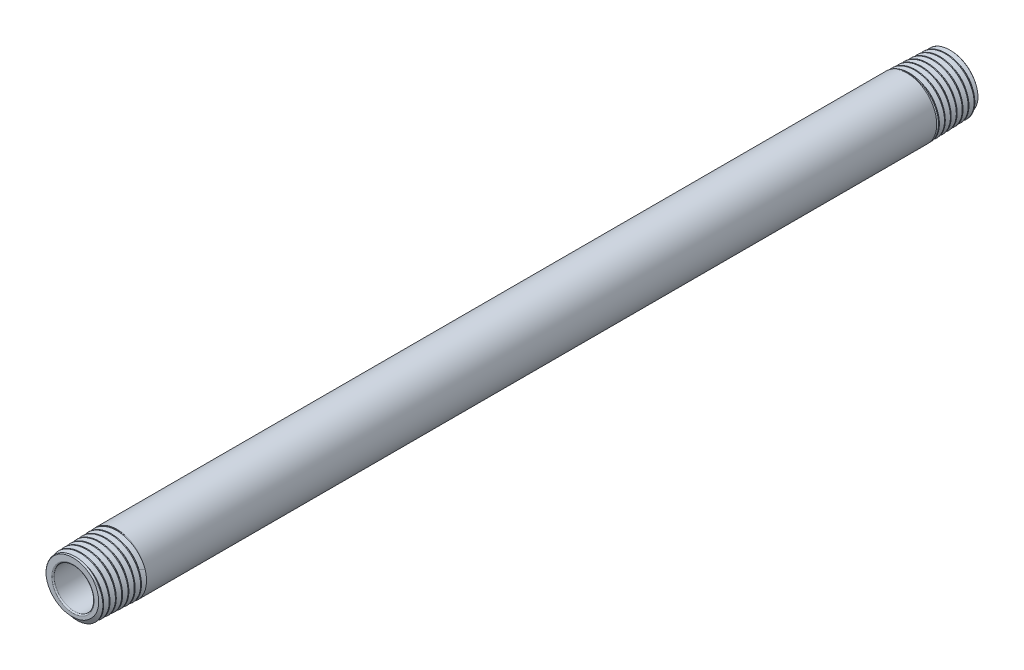
from build123d import *

# Parameters (mm, degrees)
CHAMFER1_SIZE       = 0.2794
CHAMFER1_SIZE2      = 0.28851844
FILLET1_R           = 0.2794
SKETCH6_R           = 6.858
BOSS_EXTRUDE1_DEPTH = 10.16
BOSS_EXTRUDE1_TAPER = 60
SKETCH7_R           = 4.6228
CUT_EXTRUDE1_DEPTH  = 103.061865312
CIRPATTERN1_COUNT   = 2


with BuildPart() as part:
    # Sketch2 → Revolve1 (revolve)
    with BuildSketch(Plane(origin=(0, 0, 0), x_dir=(0, 0, -1), z_dir=(1, 0, 0)), mode=Mode.PRIVATE) as revolve1_sk:
        Polygon((-101.6, 6.541667453), (-91.44, 6.858), (0, 6.858), (0, 4.6228), (-101.6, 4.6228), align=None)
    revolve(revolve1_sk.sketch.rotate(Axis((0, 0, 101.6), (0, 0, -1)), 90), axis=Axis((0, 0, 101.6), (0, 0, -1)))

    # Chamfer1
    chamfer1_edges = [part.edges().sort_by_distance(p)[0] for p in [
        (-6.541667453, 0, 101.6),
    ]]
    chamfer1_side = [part.faces().sort_by_distance(p)[0] for p in [
        (-6.699833727, 0, 96.52),
    ]]
    chamfer(chamfer1_edges, length=CHAMFER1_SIZE, length2=CHAMFER1_SIZE2, reference=chamfer1_side[0])

    # Fillet1
    fillet1_edges = [part.edges().sort_by_distance(p)[0] for p in [
        (-4.6228, 0, 101.6),
    ]]
    fillet(fillet1_edges, radius=FILLET1_R)

    # Mirror1: part across plane


with BuildPart() as part_1:
    add(part.part)
    add(part.part.mirror(Plane.XY))

    # SurfaceCut1
    split(bisect_by=Plane.XY, keep=Keep.TOP)


with BuildPart() as body_2:
    # Split1: the piece on the far side of the plane
    add(part_1.part)
    split(bisect_by=Plane.XY.offset(91.44), keep=Keep.BOTTOM)


with BuildPart() as part_2:
    add(part_1.part)

    # Split1
    split(bisect_by=Plane.XY.offset(91.44), keep=Keep.TOP)

    # Cut-Sweep1: sweep along a curve in space
    with BuildLine() as cut_sweep1_path:
        add(Edge.make_bspline(
            [(0, 6.541667453, 101.6), (0.877709824, 6.54260565, 101.569866898), (1.755426188, 6.36454889, 101.539733796), (3.371979301, 5.678320114, 101.479467593), (4.110112963, 5.170443033, 101.449334491), (5.329171692, 3.905254079, 101.389068287), (5.809565174, 3.148489228, 101.358935185), (6.435843944, 1.506162618, 101.298668981), (6.581454305, 0.621312709, 101.26853588), (6.514293191, -1.13584603, 101.208269676), (6.301547631, -2.007391876, 101.178136574), (5.551090642, -3.598488528, 101.11787037), (5.013702082, -4.317347184, 101.087737269), (3.699370211, -5.487801762, 101.027471065), (2.922995349, -5.938887116, 100.997337963), (1.254483374, -6.501167347, 100.937071759), (0.363069598, -6.612115039, 100.906938657), (-1.393109508, -6.475782942, 100.846672454), (-2.257112152, -6.228559105, 100.816539352), (-3.820197564, -5.414816609, 100.756273148), (-4.518600229, -4.848648353, 100.726140046), (-5.63846858, -3.487042596, 100.665873843), (-6.059445575, -2.692194167, 100.635740741), (-6.556635396, -0.999994035, 100.575474537), (-6.632629256, -0.103376076, 100.545341435), (-6.427099903, 1.649096883, 100.485075231), (-6.145662696, 2.504190681, 100.45494213), (-5.269679132, 4.036744925, 100.394675926), (-4.67551026, 4.713538412, 100.364542824), (-3.268579627, 5.780910407, 100.30427662), (-2.456426715, 6.171022937, 100.274143519), (-0.743081048, 6.602128049, 100.213877315), (0.15736866, 6.642930322, 100.183744213), (1.903405405, 6.368285053, 100.123478009), (2.748233908, 6.05295354, 100.093344907), (4.24777596, 5.115873787, 100.033078704), (4.901836774, 4.494529623, 100.002945602), (5.914877466, 3.044300325, 99.942679398), (6.273414878, 2.21604294, 99.912546296), (6.637540441, 0.484135954, 99.852280093), (6.642967332, -0.418762418, 99.822146991), (6.299395332, -2.155633579, 99.761880787), (5.950542417, -2.988851685, 99.731747685), (4.953610351, -4.452943436, 99.671481481), (4.305961329, -5.083179628, 99.64134838), (2.814533876, -6.040132368, 99.581082176), (1.971401186, -6.366430729, 99.550949074), (0.223554795, -6.662783093, 99.49068287), (-0.680400632, -6.632705236, 99.460549769), (-2.405381798, -6.22050361, 99.400283565), (-3.225657894, -5.838555639, 99.370150463), (-4.651908099, -4.783112521, 99.309884259), (-5.25726108, -4.110072979, 99.279751157), (-6.156450528, -2.579619152, 99.219484954), (-6.449893819, -1.722867659, 99.189351852), (-6.67778211, 0.038262492, 99.129085648), (-6.612124955, 0.941876983, 99.098952546), (-6.131698625, 2.652252983, 99.038686343), (-5.717134899, 3.458271065, 99.008553241), (-4.604617611, 4.84433924, 98.948287037), (-3.90714451, 5.423785548, 98.918153935), (-2.339904207, 6.263620563, 98.857887731), (-1.470815879, 6.523641801, 98.82775463), (0.30091269, 6.682479344, 98.767488426), (1.202784035, 6.581223457, 98.737355324), (2.895853203, 6.033084895, 98.67708912), (3.686314989, 5.586437102, 98.646956019), (5.029915236, 4.418376226, 98.586689815), (5.58246825, 3.697467799, 98.556556713), (6.361444662, 2.095745767, 98.496290509), (6.587526952, 1.215626119, 98.466157407), (6.676832539, -0.563989923, 98.405891204), (6.540013822, -1.462713871, 98.375758102), (5.924782611, -3.135792311, 98.315491898), (5.446634168, -3.909419327, 98.285358796), (4.224651908, -5.208324087, 98.225092593), (3.481346242, -5.733035696, 98.194959491), (1.847508697, -6.449738943, 98.134693287), (0.957684834, -6.641416456, 98.104560185), (-0.827086282, -6.660815453, 98.044293981), (-1.721258724, -6.488525269, 98.01416088), (-3.371684567, -5.806927495, 97.953894676), (-4.127220207, -5.297912817, 97.923761574), (-5.379263938, -4.023720777, 97.86349537), (-5.875226147, -3.259094322, 97.833362269), (-6.528333789, -1.595565458, 97.773096065), (-6.685192659, -0.697384073, 97.742962963), (-6.634417948, 1.089792458, 97.682696759), (-6.426803167, 1.978011621, 97.652563657), (-5.679670645, 3.603149251, 97.592297454), (-5.140474318, 4.339360818, 97.562164352), (-3.815871127, 5.542443584, 97.501898148), (-3.031037147, 6.008790068, 97.471765046), (-1.340295547, 6.597074161, 97.411498843), (-0.435120885, 6.718753304, 97.381365741), (1.35169838, 6.597646062, 97.321099537), (2.232567026, 6.354909017, 97.290966435), (3.829811285, 5.543178344, 97.230700231), (4.545491993, 4.974534231, 97.20056713), (5.697582959, 3.601403025, 97.140300926), (6.133490558, 2.797509982, 97.110167824), (6.655819886, 1.082084927, 97.04990162), (6.742011744, 0.171296711, 97.019768519), (6.550522053, -1.612393852, 96.959502315), (6.272920411, -2.484521474, 96.929369213), (5.397631855, -4.051301832, 96.869103009), (4.800322108, -4.745272777, 96.838969907), (3.380627875, -5.844413619, 96.778703704), (2.558857751, -6.249103764, 96.748570602), (0.821325443, -6.704445931, 96.688304398), (-0.093683227, -6.754897128, 96.658171296), (-1.871469198, -6.493084415, 96.597905093), (-2.733474212, -6.180930959, 96.567771991), (-4.267258899, -5.243227181, 96.507505787), (-4.938370996, -4.618081188, 96.477372685), (-5.982679194, -3.153867968, 96.417106481), (-6.355419274, -2.315434535, 96.38697338), (-6.742842643, -0.558414226, 96.326707176), (-6.757354565, 0.35941055, 96.296574074), (-6.425387878, 2.128515906, 96.23630787), (-6.0790502, 2.979027841, 96.206174769), (-5.080174809, 4.477327926, 96.145908565), (-4.428068052, 5.124463798, 96.115775463), (-2.921456015, 6.112135833, 96.055509259), (-2.067603042, 6.452240491, 96.025376157), (-0.293753093, 6.770915978, 95.965109954), (0.625474352, 6.749345262, 95.934976852), (2.383127268, 6.347503366, 95.874710648), (3.220788941, 5.96740348, 95.844577546), (4.681162363, 4.908699432, 95.784311343), (5.303238195, 4.230552272, 95.754178241), (6.232552626, 2.683734657, 95.693912037), (6.539384986, 1.815734071, 95.663778935), (6.788587694, 0.027747927, 95.603512731), (6.730846637, -0.891461835, 95.57337963), (6.259517949, -2.634899027, 95.513113426), (5.846131809, -3.458368707, 95.482980324), (4.729039636, -4.878424244, 95.42271412), (4.025816031, -5.474391586, 95.392581019), (2.441055964, -6.343712008, 95.332314815), (1.560205954, -6.616684832, 95.302181713), (-0.239191941, -6.795795529, 95.241915509), (-1.156958949, -6.701852412, 95.211782407), (-2.883430018, -6.161534754, 95.151516204), (-3.691383572, -5.715391691, 95.121383102), (-5.068784741, -4.541447578, 95.061116898), (-5.637632261, -3.814153717, 95.030983796), (-6.445410146, -2.193780911, 94.970717593), (-6.683986916, -1.301403992, 94.940584491), (-6.79249335, 0.506654363, 94.880318287), (-6.662372668, 1.421551037, 94.850185185), (-6.053672855, 3.128322804, 94.789918981), (-5.57535493, 3.919455822, 94.75978588), (-4.346188632, 5.25192471, 94.699519676), (-3.595871507, 5.792679897, 94.669386574), (-1.942278846, 6.537457302, 94.60912037), (-1.039719873, 6.74115322, 94.578987269), (0.774225013, 6.778651278, 94.518721065), (1.684823482, 6.612433893, 94.488587963), (3.369184312, 5.936067146, 94.428321759), (4.142214209, 5.426208412, 94.398188657), (5.427535223, 4.14354102, 94.337922454), (5.939266033, 3.371286925, 94.307789352), (6.619678173, 1.686926936, 94.247523148), (6.788061097, 0.775551078, 94.217390046), (6.754255787, -1.041488025, 94.157123843), (6.552078985, -1.946362356, 94.126990741), (5.808868172, -3.605626463, 94.066724537), (5.268153858, -4.359294555, 94.036591435), (3.933795415, -5.595318085, 93.976325231), (3.140728382, -6.07713453, 93.94619213), (1.428109601, -6.691912219, 93.885925926), (0.509300279, -6.824603505, 93.855792824), (-1.308026642, -6.719309782, 93.79552662), (-2.205755072, -6.481367245, 93.765393519), (-3.837266799, -5.672241951, 93.705127315), (-4.570340344, -5.101407562, 93.674994213), (-5.754986337, -3.717254528, 93.614728009), (-6.206042014, -2.904534693, 93.584594907), (-6.754013957, -1.166217939, 93.524328704), (-6.85068923, -0.241374724, 93.494195602), (-6.673832643, 1.573423863, 93.433929398), (-6.400374334, 2.462591036, 93.403796296), (-5.526369763, 4.063729095, 93.343530093), (-4.926200094, 4.775003303, 93.313396991), (-3.494232673, 5.90626474, 93.253130787), (-2.663054587, 6.325758293, 93.222997685), (-0.901649134, 6.805853243, 93.162731481), (0.027814386, 6.866243079, 93.13259838), (1.837263098, 6.617860253, 93.072332176), (2.71646229, 6.30919221, 93.042199074), (4.284643971, 5.371447914, 92.98193287), (4.972943979, 4.74277599, 92.951799769), (6.048890247, 3.265055312, 92.891533565), (6.436066767, 2.41664619, 92.861400463), (6.84731552, 0.63480585, 92.801134259), (6.871206049, -0.297852524, 92.771001157), (6.551444993, -2.099128822, 92.710734954), (6.207929035, -2.966964167, 92.680601852), (5.20768748, -4.499649494, 92.620335648), (4.551393413, -5.163832297, 92.590202546), (3.030058583, -6.18261245, 92.529936343), (2.165676493, -6.536764808, 92.499803241), (0.366095625, -6.878302053, 92.439537037), (-0.568322481, -6.865535475, 92.409403935), (-2.358607226, -6.474655714, 92.349137731), (-3.213695933, -6.096709059, 92.31900463), (-4.708391767, -5.035314021, 92.258738426), (-5.347348104, -4.352323791, 92.228605324), (-6.30719402, -2.789588808, 92.16833912), (-6.627664123, -1.910520807, 92.138206019), (-6.898730131, -0.095930242, 92.077939815), (-6.849205145, 0.838805009, 92.047806713), (-6.387577683, 2.615286874, 91.987540509), (-5.975672477, 3.456261422, 91.957407407), (-4.85456728, 4.91052551, 91.897141204), (-4.145851438, 5.523181708, 91.867008102), (-2.544001979, 6.422411112, 91.806741898), (-1.651562206, 6.708591095, 91.776608796), (0.175274896, 6.908533253, 91.716342593), (1.108879468, 6.8222054, 91.686209491), (2.868759351, 6.290312501, 91.625943287), (3.694269681, 5.844975265, 91.595810185), (5.105714628, 4.665700847, 91.535543981), (5.691034394, 3.932273148, 91.50541088), (6.52805377, 2.293663241, 91.445144676), (6.779387103, 1.389190947, 91.415011574), (6.90766128, -0.447101409, 91.35474537), (6.784543198, -1.378124484, 91.324612269), (6.182977999, -3.118619916, 91.264346065), (5.704788981, -3.927335589, 91.234212963), (4.468981813, -5.293632768, 91.173946759), (3.711897774, -5.850618927, 91.143813657), (2.03894634, -6.623926289, 91.083547454), (1.123803885, -6.839908819, 91.053414352), (-0.719128585, -6.896080569, 90.993148148), (-1.646118601, -6.736242158, 90.963015046), (-3.364468147, -6.065708105, 90.902748843), (-4.155080486, -5.555300548, 90.872615741), (-5.47396386, -4.264690389, 90.812349537), (-6.00166004, -3.485045778, 90.782216435), (-6.709847577, -1.780233075, 90.721950231), (-6.890028481, -0.855803872, 90.69181713), (-6.873774076, 0.990934029, 90.631550926), (-6.677342578, 1.912440949, 90.601417824), (-5.938652687, 3.605908578, 90.54115162), (-5.396712016, 4.377132781, 90.511018519), (-4.053119517, 5.646402645, 90.450752315), (-3.252048772, 6.143894902, 90.420619213), (-1.517912718, 6.78565148, 90.360353009), (-0.585599148, 6.929634143, 90.330219907), (1.26209432, 6.84074144, 90.269953704), (2.176671897, 6.607901424, 90.239820602), (3.842551341, 5.801977365, 90.179554398), (4.593128564, 5.229240287, 90.149421296), (5.810655191, 3.834574444, 90.089155093), (6.277073568, 3.013249031, 90.059021991), (6.564130329, 2.132815233, 90.028888889)],
            knots=[0, 0, 0, 0, 0.0078125, 0.0078125, 0.015625, 0.015625, 0.0234375, 0.0234375, 0.03125, 0.03125, 0.0390625, 0.0390625, 0.046875, 0.046875, 0.0546875, 0.0546875, 0.0625, 0.0625, 0.0703125, 0.0703125, 0.078125, 0.078125, 0.0859375, 0.0859375, 0.09375, 0.09375, 0.1015625, 0.1015625, 0.109375, 0.109375, 0.1171875, 0.1171875, 0.125, 0.125, 0.1328125, 0.1328125, 0.140625, 0.140625, 0.1484375, 0.1484375, 0.15625, 0.15625, 0.1640625, 0.1640625, 0.171875, 0.171875, 0.1796875, 0.1796875, 0.1875, 0.1875, 0.1953125, 0.1953125, 0.203125, 0.203125, 0.2109375, 0.2109375, 0.21875, 0.21875, 0.2265625, 0.2265625, 0.234375, 0.234375, 0.2421875, 0.2421875, 0.25, 0.25, 0.2578125, 0.2578125, 0.265625, 0.265625, 0.2734375, 0.2734375, 0.28125, 0.28125, 0.2890625, 0.2890625, 0.296875, 0.296875, 0.3046875, 0.3046875, 0.3125, 0.3125, 0.3203125, 0.3203125, 0.328125, 0.328125, 0.3359375, 0.3359375, 0.34375, 0.34375, 0.3515625, 0.3515625, 0.359375, 0.359375, 0.3671875, 0.3671875, 0.375, 0.375, 0.3828125, 0.3828125, 0.390625, 0.390625, 0.3984375, 0.3984375, 0.40625, 0.40625, 0.4140625, 0.4140625, 0.421875, 0.421875, 0.4296875, 0.4296875, 0.4375, 0.4375, 0.4453125, 0.4453125, 0.453125, 0.453125, 0.4609375, 0.4609375, 0.46875, 0.46875, 0.4765625, 0.4765625, 0.484375, 0.484375, 0.4921875, 0.4921875, 0.5, 0.5, 0.5078125, 0.5078125, 0.515625, 0.515625, 0.5234375, 0.5234375, 0.53125, 0.53125, 0.5390625, 0.5390625, 0.546875, 0.546875, 0.5546875, 0.5546875, 0.5625, 0.5625, 0.5703125, 0.5703125, 0.578125, 0.578125, 0.5859375, 0.5859375, 0.59375, 0.59375, 0.6015625, 0.6015625, 0.609375, 0.609375, 0.6171875, 0.6171875, 0.625, 0.625, 0.6328125, 0.6328125, 0.640625, 0.640625, 0.6484375, 0.6484375, 0.65625, 0.65625, 0.6640625, 0.6640625, 0.671875, 0.671875, 0.6796875, 0.6796875, 0.6875, 0.6875, 0.6953125, 0.6953125, 0.703125, 0.703125, 0.7109375, 0.7109375, 0.71875, 0.71875, 0.7265625, 0.7265625, 0.734375, 0.734375, 0.7421875, 0.7421875, 0.75, 0.75, 0.7578125, 0.7578125, 0.765625, 0.765625, 0.7734375, 0.7734375, 0.78125, 0.78125, 0.7890625, 0.7890625, 0.796875, 0.796875, 0.8046875, 0.8046875, 0.8125, 0.8125, 0.8203125, 0.8203125, 0.828125, 0.828125, 0.8359375, 0.8359375, 0.84375, 0.84375, 0.8515625, 0.8515625, 0.859375, 0.859375, 0.8671875, 0.8671875, 0.875, 0.875, 0.8828125, 0.8828125, 0.890625, 0.890625, 0.8984375, 0.8984375, 0.90625, 0.90625, 0.9140625, 0.9140625, 0.921875, 0.921875, 0.9296875, 0.9296875, 0.9375, 0.9375, 0.9453125, 0.9453125, 0.953125, 0.953125, 0.9609375, 0.9609375, 0.96875, 0.96875, 0.9765625, 0.9765625, 0.984375, 0.984375, 0.9921875, 0.9921875, 1, 1, 1, 1], degree=3))
    # Sketch4 → Cut-Sweep1 (sweep, cut)
    with BuildSketch(Plane(origin=(0, 0, 0), x_dir=(0, 0, -1), z_dir=(1, 0, 0))):
        Polygon((-102.305555556, 5.625123901), (-102.129166667, 5.625123901), (-101.511805556, 6.694424712), (-102.878819444, 6.618046082), align=None)
    sweep(path=cut_sweep1_path.line, is_frenet=True, mode=Mode.SUBTRACT)

    add(body_2.part)  # Boss-Extrude1 merges body 2
    # Sketch6 → Boss-Extrude1 (add, through all)
    with BuildSketch(Plane.XY.offset(91.44)):
        Circle(SKETCH6_R)
    extrude(amount=BOSS_EXTRUDE1_DEPTH, taper=BOSS_EXTRUDE1_TAPER)

    # Sketch7 → Cut-Extrude1 (cut, through all)
    with BuildSketch(Plane.XY):
        Circle(SKETCH7_R)
    extrude(amount=CUT_EXTRUDE1_DEPTH, mode=Mode.SUBTRACT)


with BuildPart() as cirpattern1_1:
    # CirPattern1: pattern copy
    add(part_2.part.rotate(Axis((0, 6.858, 0), (0, -1, 0)), 1 * 360 / CIRPATTERN1_COUNT))

    # Combine1: union part
    add(part_2.part)


solid = cirpattern1_1.part
